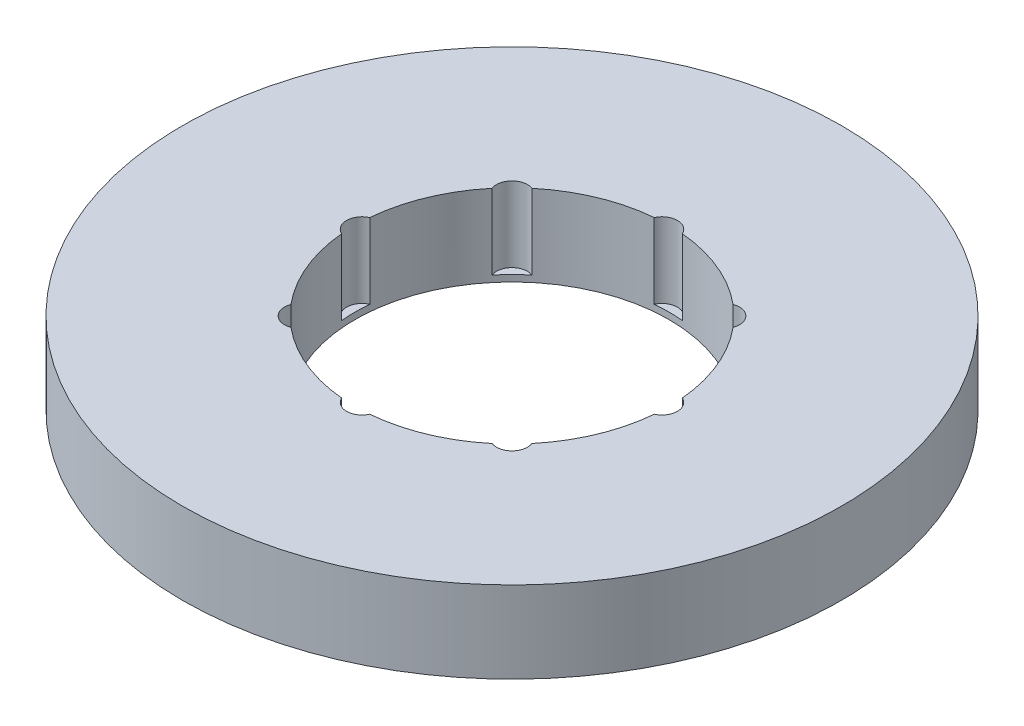
from build123d import *

# Parameters (mm, degrees)
SKETCH1_R           = 52.5
BOSS_EXTRUDE1_DEPTH = 13
SKETCH2_R           = 25
CUT_EXTRUDE1_DEPTH  = 76.375725535
SKETCH3_R           = 2.460552854
CUT_EXTRUDE2_DEPTH  = 11.967461035
CIRPATTERN1_COUNT   = 8


with BuildPart() as part:
    # Sketch1 → Boss-Extrude1 (new body)
    with BuildSketch(Plane(origin=(0, 0, 0), x_dir=(1, 0, 0), z_dir=(0, 1, 0))):
        Circle(SKETCH1_R)
    extrude(amount=BOSS_EXTRUDE1_DEPTH)

    # Sketch2 → Cut-Extrude1 (cut, through all)
    with BuildSketch(Plane(origin=(0, 0, 0), x_dir=(1, 0, 0), z_dir=(0, 1, 0))):
        Circle(SKETCH2_R)
    extrude(amount=CUT_EXTRUDE1_DEPTH, mode=Mode.SUBTRACT)

    # Sketch3 → Cut-Extrude2 (cut)
    with BuildSketch(Plane(origin=(0, 13, 0), x_dir=(1, 0, 0), z_dir=(0, 1, 0))):
        with Locations((-23.882542415, 0)):
            Circle(SKETCH3_R)
    cut_extrude2 = extrude(amount=-CUT_EXTRUDE2_DEPTH, mode=Mode.SUBTRACT)

    # CirPattern1: Cut-Extrude2 ×8 about axis
    cirpattern1_axis = Axis((0, 0, 0), (0, 1, 0))
    for i in range(1, CIRPATTERN1_COUNT):
        add(cut_extrude2.rotate(cirpattern1_axis, i * 360 / CIRPATTERN1_COUNT), mode=Mode.SUBTRACT)


solid = part.part
